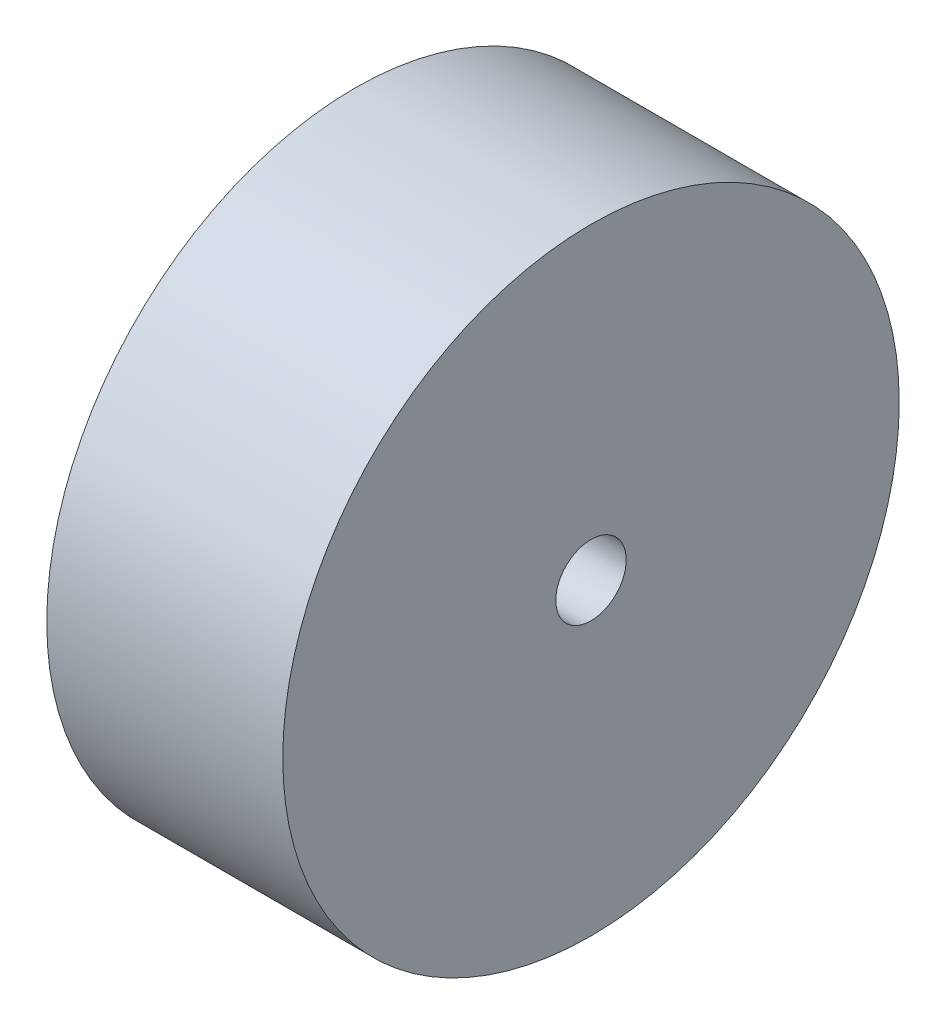
from build123d import *

# Parameters (mm, degrees)
BOSS_EXTRUDE1_DEPTH      = 6.7
BOSS_EXTRUDE1_DEPTH_BACK = 6.7
SKETCH1_R                = 17.5
SKETCH2_R                = 2
CUT_EXTRUDE1_DEPTH       = 29.143560542


with BuildPart() as part:
    # Sketch1 → Boss-Extrude1 (new, two sides: drawn at the far end of the back side and taken through both)
    with BuildSketch(Plane(origin=(0, 0, 0), x_dir=(0, 0, -1), z_dir=(1, 0, 0)).offset(-BOSS_EXTRUDE1_DEPTH_BACK)):
        Circle(SKETCH1_R)
    extrude(amount=BOSS_EXTRUDE1_DEPTH + BOSS_EXTRUDE1_DEPTH_BACK)

    # Sketch2 → Cut-Extrude1 (cut, through all)
    with BuildSketch(Plane(origin=(6.7, 0, 0), x_dir=(0, 0, -1), z_dir=(1, 0, 0))):
        Circle(SKETCH2_R)
    extrude(amount=-CUT_EXTRUDE1_DEPTH, mode=Mode.SUBTRACT)


solid = part.part
